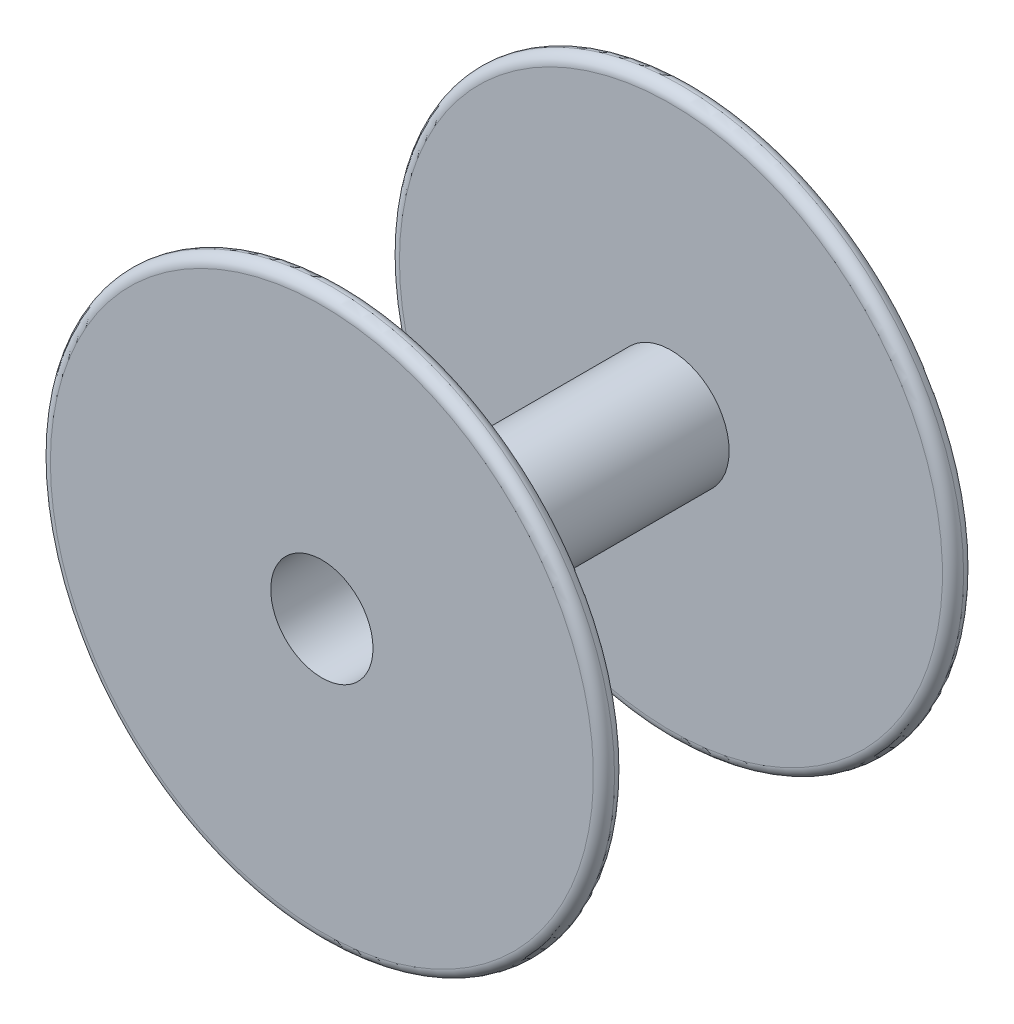
from build123d import *

# Parameters (mm, degrees)
FILLET1_R = 3


with BuildPart() as part:
    # Sketch1 → Revolve1 (revolve)
    with BuildSketch(Plane(origin=(0, 0, 0), x_dir=(0, 0, -1), z_dir=(1, 0, 0)), mode=Mode.PRIVATE) as revolve1_sk:
        Polygon((-52.5, 80), (-52.5, 14.5), (52.5, 14.5), (52.5, 80), (46.5, 80), (46.5, 16.5), (-46.5, 16.5), (-46.5, 80), align=None)
    revolve(revolve1_sk.sketch.rotate(Axis((0, 0, 0), (0, 0, -1)), 90), axis=Axis((0, 0, 0), (0, 0, -1)))

    # Fillet1
    fillet1_edges = [part.edges().sort_by_distance(p)[0] for p in [
        (-80, 0, 46.5),
        (-80, 0, -46.5),
        (-80, 0, -52.5),
        (-80, 0, 52.5),
    ]]
    fillet(fillet1_edges, radius=FILLET1_R - 0.0001)  # a hair under: the kernel refuses the full size


solid = part.part
